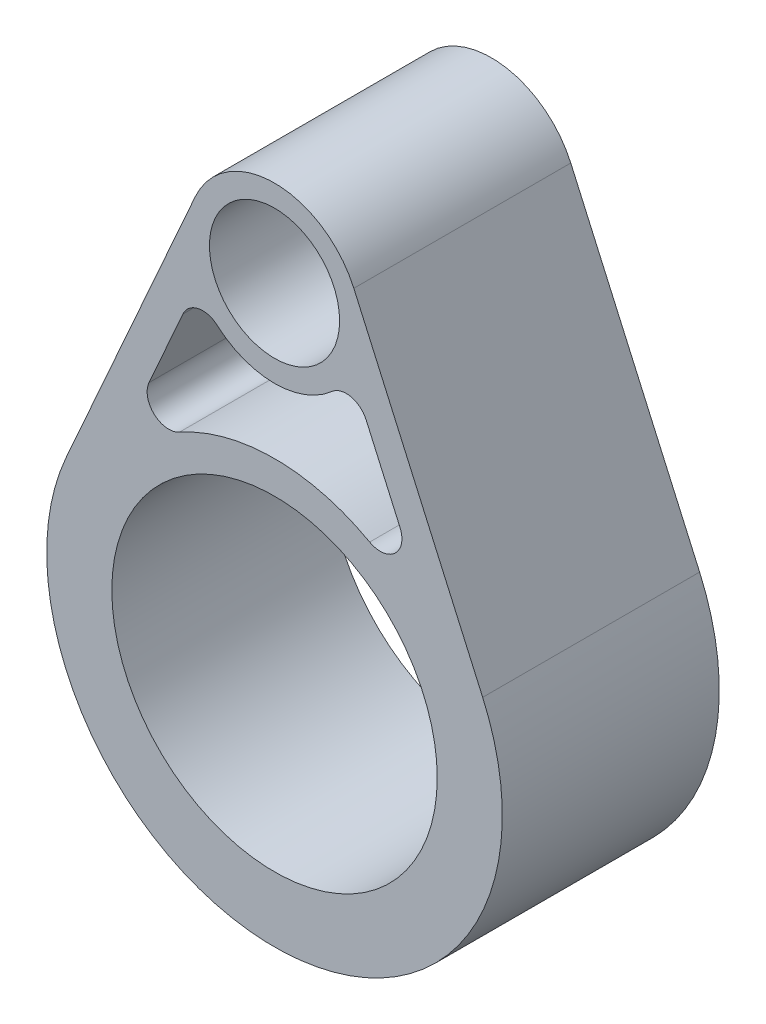
from build123d import *

# Parameters (mm, degrees)
SKETCH1_R               = 75
BOSS_EXTRUDE1_DEPTH     = 50
CUT_EXTRUDE1_DEPTH      = 290.39592257
CUT_EXTRUDE1_DEPTH_BACK = 290.39592257
FILLET1_START           = -50
FILLET1_DEPTH           = 100
SKETCH3_R               = 30
CUT_EXTRUDE2_DEPTH      = 303.07614934


with BuildPart() as part:
    # Sketch1 → Boss-Extrude1 (new, symmetric)
    with BuildSketch(Plane.XY):
        with BuildLine():
            Line((-95.945006832, -117.34375), (-36.550478793, 16.25))
            ThreePointArc((-36.550478793, 16.25), (0, 40), (36.550478793, 16.25))
            Line((36.550478793, 16.25), (95.945006832, -117.34375))
            ThreePointArc((95.945006832, -117.34375), (0, -265), (-95.945006832, -117.34375))
        make_face()
        with Locations((0, -160)):
            Circle(SKETCH1_R, mode=Mode.SUBTRACT)
    extrude(amount=BOSS_EXTRUDE1_DEPTH, both=True)

    # Sketch2 → Cut-Extrude1 (cut, two sides: drawn at the far end of the back side and taken through both)
    with BuildSketch(Plane.XY.offset(-CUT_EXTRUDE1_DEPTH_BACK)):
        with BuildLine():
            Line((-35.52920143, -18.375958363), (-82.238577284, -123.4375))
            ThreePointArc((-82.238577284, -123.4375), (0, -70), (82.238577284, -123.4375))
            Line((82.238577284, -123.4375), (35.52920143, -18.375958363))
            ThreePointArc((35.52920143, -18.375958363), (0, -40), (-35.52920143, -18.375958363))
        make_face()
    extrude(amount=CUT_EXTRUDE1_DEPTH + CUT_EXTRUDE1_DEPTH_BACK, mode=Mode.SUBTRACT)

    # Fillet1: read off the stored shape, not the designer's step
    # Fillet1 outline → Fillet1 (add)
    with BuildSketch(Plane.XY.offset(FILLET1_START)):
        with BuildLine():
            ThreePointArc((-42.220939274, -33.427418189), (-35.213916082, -27.719526256), (-26.466655661, -29.991934551))
            ThreePointArc((-26.466655661, -29.991934551), (-31.537347698, -24.604790188), (-35.52920143, -18.375958363))
            Line((-35.52920143, -18.375958363), (-42.220939274, -33.427418189))
        make_face()
        with BuildLine():
            ThreePointArc((35.52920143, -18.375958363), (31.537347698, -24.604790188), (26.466655661, -29.991934551))
            ThreePointArc((26.466655661, -29.991934551), (35.213916082, -27.719526256), (42.220939274, -33.427418189))
            Line((42.220939274, -33.427418189), (35.52920143, -18.375958363))
        make_face()
        with BuildLine():
            ThreePointArc((-43.853361827, -81.406853629), (-55.469552548, -80.058313703), (-57.863577284, -68.61178181))
            Line((-57.863577284, -68.61178181), (-82.238577284, -123.4375))
            ThreePointArc((-82.238577284, -123.4375), (-66.45628703, -99.30764534), (-43.853361827, -81.406853629))
        make_face()
        with BuildLine():
            Line((82.238577284, -123.4375), (57.863577284, -68.61178181))
            ThreePointArc((57.863577284, -68.61178181), (55.469552548, -80.058313703), (43.853361827, -81.406853629))
            ThreePointArc((43.853361827, -81.406853629), (66.45628703, -99.30764534), (82.238577284, -123.4375))
        make_face()
    extrude(amount=FILLET1_DEPTH)

    # Sketch3 → Cut-Extrude2 (cut, through all)
    with BuildSketch(Plane.XY.offset(50)):
        Circle(SKETCH3_R)
    extrude(amount=-CUT_EXTRUDE2_DEPTH, mode=Mode.SUBTRACT)


solid = part.part
